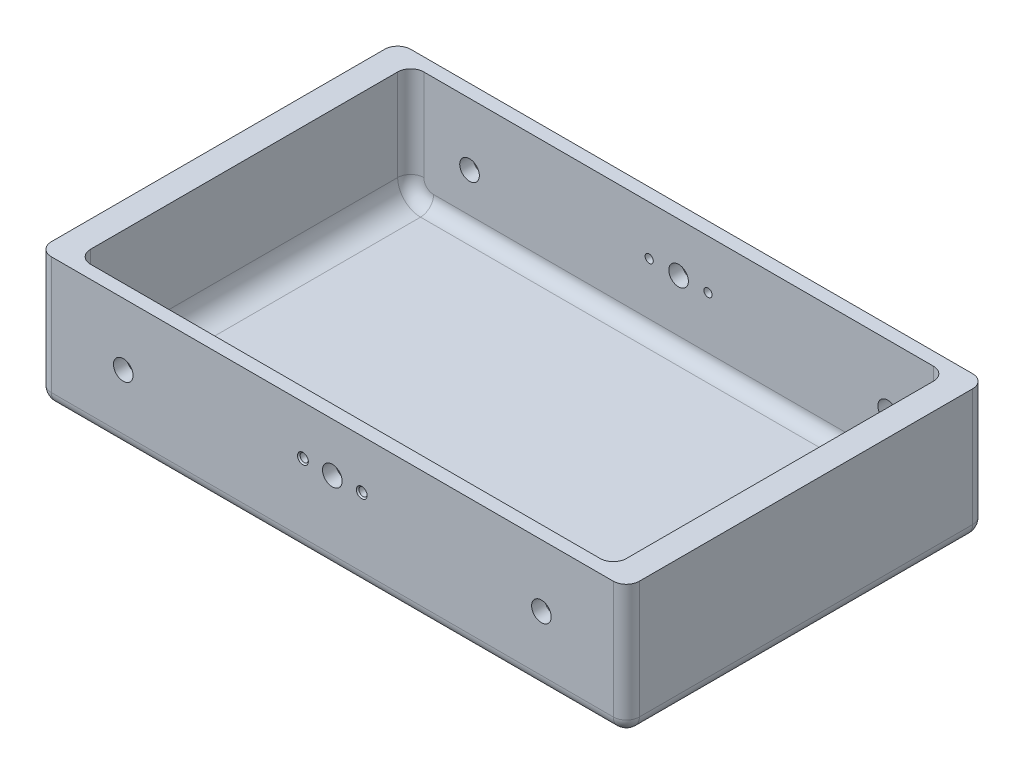
from build123d import *

# Parameters (mm, degrees)
ESQUISSE1_W                   = 90
ESQUISSE1_H                   = 20
ESQUISSE1_R                   = 1.5
BOSS_EXTRU_1_DEPTH            = 2
ESQUISSE2_W                   = 90
ESQUISSE2_H                   = 20
BOSS_EXTRU_2_DEPTH            = 51
ENL_V_MAT_EXTRU_2_DEPTH       = 51
ESQUISSE6_W                   = 90
ESQUISSE6_H                   = 20
ESQUISSE6_R                   = 1.5
BOSS_EXTRU_4_DEPTH            = 2
TROU_TARAUD_M1_61_D           = 1.25
TROU_TARAUD_M1_61_DEPTH       = 2
TROU_TARAUD_M1_61_CSINK_D     = 1.65
TROU_TARAUD_M1_61_CSINK_ANGLE = 90
TROU_TARAUD_M1_62_D           = 1.25
TROU_TARAUD_M1_62_DEPTH       = 2
TROU_TARAUD_M1_62_CSINK_D     = 1.65
TROU_TARAUD_M1_62_CSINK_ANGLE = 90
CONG_1_R                      = 2
CONG_2_R                      = 2
CONG_3_R                      = 2
CONG_4_R                      = 2


with BuildPart() as part:
    # Esquisse1 → Boss.-Extru.1 (new body)
    with BuildSketch(Plane.XY):
        with Locations((0, 10)):
            Rectangle(ESQUISSE1_W, ESQUISSE1_H)
        with Locations((-32, 10.5)):
            Circle(ESQUISSE1_R, mode=Mode.SUBTRACT)
        with Locations((32, 10.5)):
            Circle(ESQUISSE1_R, mode=Mode.SUBTRACT)
        with Locations((0, 12.5)):
            Circle(ESQUISSE1_R, mode=Mode.SUBTRACT)
    extrude(amount=BOSS_EXTRU_1_DEPTH)

    # Esquisse2 → Boss.-Extru.2 (add)
    with BuildSketch(Plane.XY.offset(2)):
        with Locations((0, 10)):
            Rectangle(ESQUISSE2_W, ESQUISSE2_H)
    extrude(amount=BOSS_EXTRU_2_DEPTH)

    # Esquisse4 → Enlèv. mat.-Extru.2 (cut)
    with BuildSketch(Plane.XY.offset(53)):
        with BuildLine():
            Line((-37.5, 2.5), (37.5, 2.5))
            ThreePointArc((37.5, 2.5), (39.974873734, 3.525126266), (41, 6))
            Line((41, 6), (41, 20))
            Line((41, 20), (-41, 20))
            Line((-41, 20), (-41, 6))
            ThreePointArc((-41, 6), (-39.974873734, 3.525126266), (-37.5, 2.5))
        make_face()
    extrude(amount=-ENL_V_MAT_EXTRU_2_DEPTH, mode=Mode.SUBTRACT)

    # Esquisse6 → Boss.-Extru.4 (add)
    with BuildSketch(Plane.XY.offset(53)):
        with Locations((0, 10)):
            Rectangle(ESQUISSE6_W, ESQUISSE6_H)
        with Locations((32, 10.5)):
            Circle(ESQUISSE6_R, mode=Mode.SUBTRACT)
        with Locations((0, 12.5)):
            Circle(ESQUISSE6_R, mode=Mode.SUBTRACT)
        with Locations((-32, 10.5)):
            Circle(ESQUISSE6_R, mode=Mode.SUBTRACT)
    extrude(amount=BOSS_EXTRU_4_DEPTH)

    # Trou taraudé M1.61
    with Locations(Plane.XY.offset(55)):
        with Locations((-4.5, 12.5), (4.5, 12.5)):
            CounterSinkHole(TROU_TARAUD_M1_61_D / 2, TROU_TARAUD_M1_61_CSINK_D / 2, depth=TROU_TARAUD_M1_61_DEPTH, counter_sink_angle=TROU_TARAUD_M1_61_CSINK_ANGLE)

    # Trou taraudé M1.62
    with Locations(Plane(origin=(0, 0, 0), x_dir=(-1, 0, 0), z_dir=(0, 0, -1))):
        with Locations((-4.5, 12.497038502), (4.5, 12.497038502)):
            CounterSinkHole(TROU_TARAUD_M1_62_D / 2, TROU_TARAUD_M1_62_CSINK_D / 2, depth=TROU_TARAUD_M1_62_DEPTH, counter_sink_angle=TROU_TARAUD_M1_62_CSINK_ANGLE)

    # Congé1
    cong_1_edges = [part.edges().sort_by_distance(p)[0] for p in [
        (-39.974873734, 3.525126266, 2),
        (-41, 13, 2),
        (41, 13, 2),
        (39.974873734, 3.525126266, 2),
        (0, 2.5, 2),
    ]]
    fillet(cong_1_edges, radius=CONG_1_R)

    # Congé2
    cong_2_edges = [part.edges().sort_by_distance(p)[0] for p in [
        (-39.974873734, 3.525126266, 53),
        (0, 2.5, 53),
        (39.974873734, 3.525126266, 53),
        (41, 13, 53),
        (-41, 13, 53),
    ]]
    fillet(cong_2_edges, radius=CONG_2_R)

    # Congé3
    cong_3_edges = [part.edges().sort_by_distance(p)[0] for p in [
        (0, 0, 0),
        (0, 0, 55),
        (45, 0, 27.5),
        (-45, 0, 27.5),
    ]]
    fillet(cong_3_edges, radius=CONG_3_R)

    # Congé4
    # the kernel refuses this fillet: 2 mm, written as the material it takes off along each edge
    with BuildSketch(Plane(origin=(43, 2, 53), x_dir=(0, 0, 1), z_dir=(1, 0, 0))) as cong_4_piece_1_section:
        Polygon((0, 0), (CONG_4_R, 0), (CONG_4_R, CONG_4_R), (0, CONG_4_R), align=None)
    cong_4_piece_1 = extrude(amount=CONG_4_R, mode=Mode.PRIVATE)
    cong_4_piece_1 = cong_4_piece_1 - Plane(origin=(43, 2, 53), x_dir=(0, 0.7071067811865475, -0.7071067811865475), z_dir=(1, 0, 0)) * Sphere(CONG_4_R, mode=Mode.PRIVATE)
    add(cong_4_piece_1, mode=Mode.SUBTRACT)
    with BuildSketch(Plane(origin=(43, 2, 2), x_dir=(1, 0, 0), z_dir=(0, 0, -1))) as cong_4_piece_2_section:
        Polygon((0, 0), (CONG_4_R, 0), (CONG_4_R, CONG_4_R), (0, CONG_4_R), align=None)
    cong_4_piece_2 = extrude(amount=CONG_4_R, mode=Mode.PRIVATE)
    cong_4_piece_2 = cong_4_piece_2 - Plane(origin=(43, 2, 2), x_dir=(-0.7071067811865474, 0.7071067811865477, 0), z_dir=(0, 0, -1)) * Sphere(CONG_4_R, mode=Mode.PRIVATE)
    add(cong_4_piece_2, mode=Mode.SUBTRACT)
    with BuildSketch(Plane(origin=(-43, 2, 53), x_dir=(0, 0, 1), z_dir=(-1, 0, 0))) as cong_4_piece_3_section:
        Polygon((0, 0), (CONG_4_R, 0), (CONG_4_R, -CONG_4_R), (0, -CONG_4_R), align=None)
    cong_4_piece_3 = extrude(amount=CONG_4_R, mode=Mode.PRIVATE)
    cong_4_piece_3 = cong_4_piece_3 - Plane(origin=(-43, 2, 53), x_dir=(0, 0.7071067811865475, -0.7071067811865475), z_dir=(-1, 0, 0)) * Sphere(CONG_4_R, mode=Mode.PRIVATE)
    add(cong_4_piece_3, mode=Mode.SUBTRACT)
    with BuildSketch(Plane(origin=(-43, 2, 2), x_dir=(-1, 0, 0), z_dir=(0, 0, -1))) as cong_4_piece_4_section:
        Polygon((0, 0), (CONG_4_R, 0), (CONG_4_R, -CONG_4_R), (0, -CONG_4_R), align=None)
    cong_4_piece_4 = extrude(amount=CONG_4_R, mode=Mode.PRIVATE)
    cong_4_piece_4 = cong_4_piece_4 - Plane(origin=(-43, 2, 2), x_dir=(0.7071067811865474, 0.7071067811865477, 0), z_dir=(0, 0, -1)) * Sphere(CONG_4_R, mode=Mode.PRIVATE)
    add(cong_4_piece_4, mode=Mode.SUBTRACT)
    with BuildSketch(Plane(origin=(45, 2, 55), x_dir=(0, 0, -1), z_dir=(0, 1, 0)), Plane(origin=(-45, 25, 55), x_dir=(0, 0, -1), z_dir=(0, -1, 0))) as cong_4_piece_5:
        with BuildLine():
            CenterArc((CONG_4_R, CONG_4_R), CONG_4_R, 180, 90)
            Line((0, CONG_4_R), (0, 0))
            Line((0, 0), (CONG_4_R, 0))
        make_face()
    extrude(amount=23, mode=Mode.SUBTRACT)
    with BuildSketch(Plane(origin=(45, 25, 0), x_dir=(-1, 0, 0), z_dir=(0, -1, 0)), Plane(origin=(-45, 2, 0), x_dir=(1, 0, 0), z_dir=(0, 1, 0))) as cong_4_piece_6:
        with BuildLine():
            CenterArc((CONG_4_R, -CONG_4_R), CONG_4_R, 90, 90)
            Line((0, -CONG_4_R), (0, 0))
            Line((0, 0), (CONG_4_R, 0))
        make_face()
    extrude(amount=23, mode=Mode.SUBTRACT)


solid = part.part
